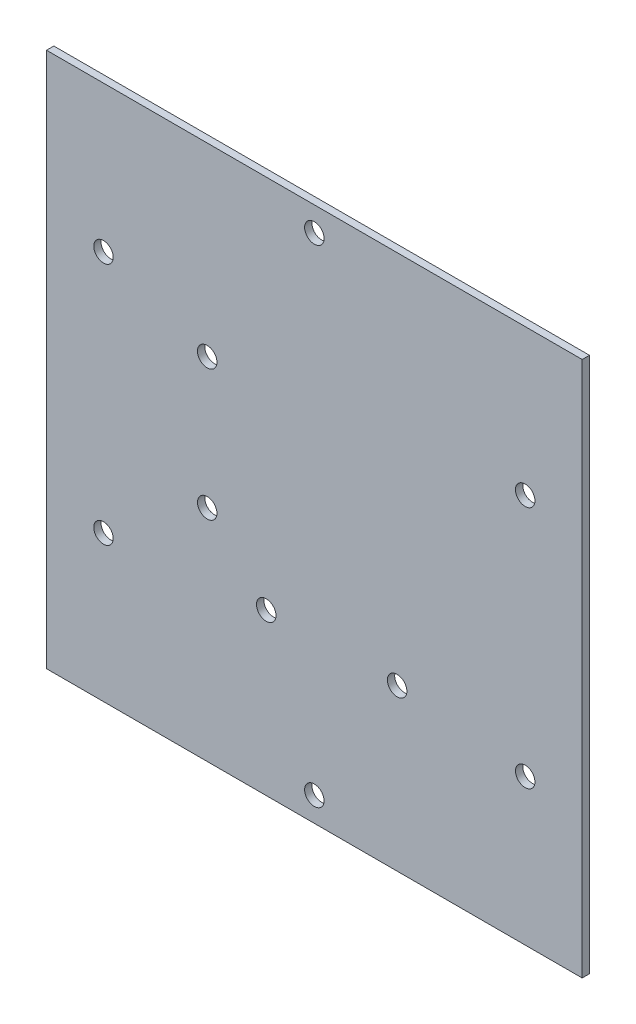
from build123d import *

# Parameters (mm, degrees)
SCHIZZO1_W               = 220
SCHIZZO1_H               = 220
SCHIZZO1_R               = 4
BASE_FLANGIA1_DEPTH      = 3
SCHIZZO2_R               = 4
TAGLIO_ESTRUSIONE1_DEPTH = 156.592416268


# Sheet-metal steps are written as plain solids
with BuildPart() as part:
    # Schizzo1 → Base-Flangia1 (new body)
    with BuildSketch(Plane.XY):
        Rectangle(SCHIZZO1_W, SCHIZZO1_H)
        with Locations((0, 100)):
            Circle(SCHIZZO1_R, mode=Mode.SUBTRACT)
        with Locations((86.602540378, 50)):
            Circle(SCHIZZO1_R, mode=Mode.SUBTRACT)
        with Locations((86.602540378, -50)):
            Circle(SCHIZZO1_R, mode=Mode.SUBTRACT)
        with Locations((0, -100)):
            Circle(SCHIZZO1_R, mode=Mode.SUBTRACT)
        with Locations((-86.602540378, -50)):
            Circle(SCHIZZO1_R, mode=Mode.SUBTRACT)
        with Locations((-86.602540378, 50)):
            Circle(SCHIZZO1_R, mode=Mode.SUBTRACT)
    extrude(amount=-BASE_FLANGIA1_DEPTH)

    # Schizzo2 → Taglio-Estrusione1 (cut, through all)
    with BuildSketch(Plane.XY):
        with Locations((-19.75, -44)):
            Circle(SCHIZZO2_R)
        with Locations((-44, -19.75)):
            Circle(SCHIZZO2_R)
        with Locations((-44, 34)):
            Circle(SCHIZZO2_R)
        with Locations((34, -44)):
            Circle(SCHIZZO2_R)
    extrude(amount=-TAGLIO_ESTRUSIONE1_DEPTH, mode=Mode.SUBTRACT)


solid = part.part
